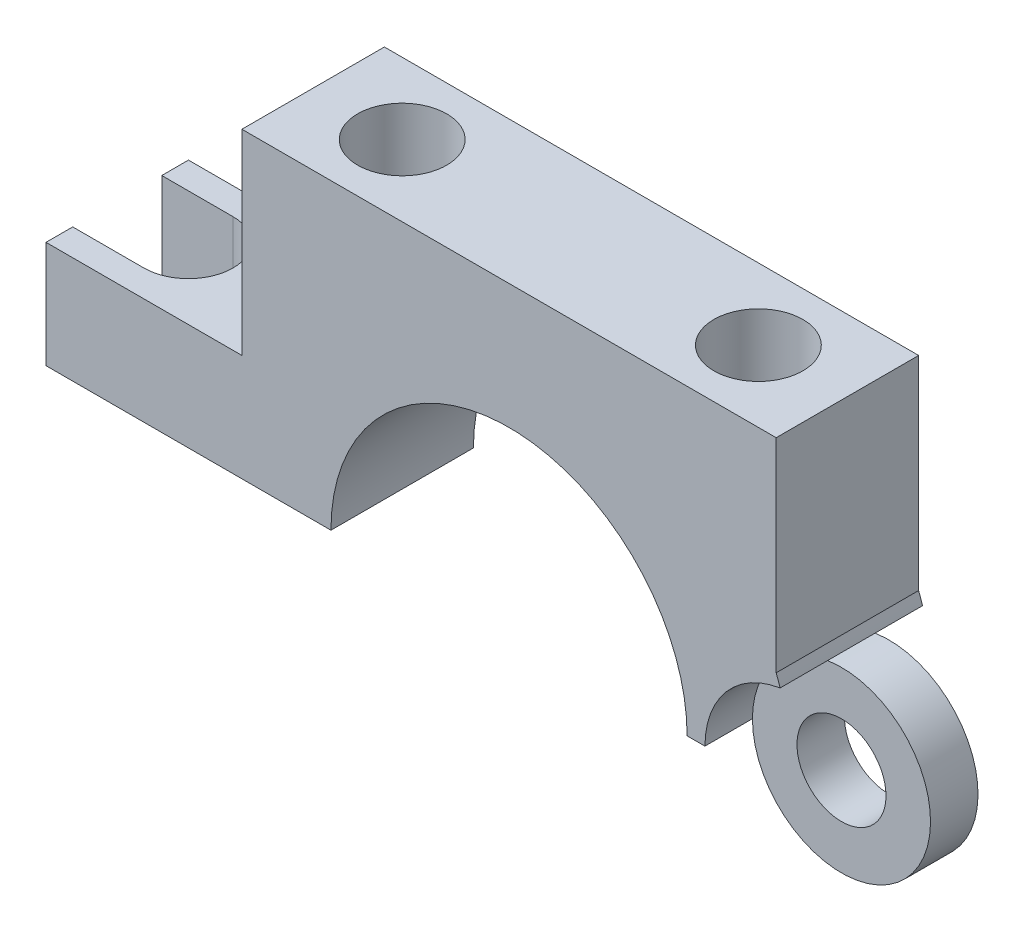
from build123d import *
from OCP.BRepAlgoAPI import BRepAlgoAPI_Cut
from OCP.TopTools import TopTools_ListOfShape

# Parameters (mm, degrees)
BOSS_EXTRUDE1_DEPTH     = 2
SKETCH2_R               = 2.5
BOSS_EXTRUDE2_DEPTH     = 0.666666667
CUT_EXTRUDE1_START      = -4
SKETCH3_R               = 1.25
CUT_EXTRUDE1_DEPTH      = 4
CUT_EXTRUDE3_DEPTH      = 15.256577429
CUT_EXTRUDE3_DEPTH_BACK = 3
BOSS_EXTRUDE3_DEPTH     = 2
CUT_EXTRUDE8_START      = -0.666667
SKETCH7_R               = 2.5
CUT_EXTRUDE8_DEPTH      = 1.333333333
CUT_EXTRUDE9_START      = 2.000000333
SKETCH8_R               = 2.5
CUT_EXTRUDE9_DEPTH      = 1.333333333
SKETCH9_R               = 1.25
CUT_EXTRUDE10_DEPTH     = 5


with BuildPart() as part:
    # Sketch1 → Boss-Extrude1 (new, symmetric)
    with BuildSketch(Plane.XY):
        with BuildLine():
            Line((-8, 0), (-5, 0))
            ThreePointArc((-5, 0), (0, 5), (5, 0))
            Line((5, 0), (8, 0))
            ThreePointArc((8, 0), (1.5281381, 7.85269342), (-7.416198487, 3))
            ThreePointArc((-7.416198487, 3), (-7.85269342, 1.5281381), (-8, 0))
        make_face()
        with BuildLine():
            Line((-13, 0), (-8, 0))
            ThreePointArc((-8, 0), (-7.85269342, 1.5281381), (-7.416198487, 3))
            Line((-7.416198487, 3), (-13, 3))
            Line((-13, 3), (-13, 0))
        make_face()
    extrude(amount=BOSS_EXTRUDE1_DEPTH, both=True)

    # Sketch2 → Boss-Extrude2 (add, symmetric)
    with BuildSketch(Plane.XY):
        with Locations((8, 0)):
            Circle(SKETCH2_R)
    extrude(amount=BOSS_EXTRUDE2_DEPTH, both=True)

    # Sketch3 → Cut-Extrude1 (cut)
    with BuildSketch(Plane.XY.offset(2).offset(CUT_EXTRUDE1_START)):
        with Locations(Location((8, 0, 0), (0, 0, 94.480798786))):
            Circle(SKETCH3_R)
    extrude(amount=CUT_EXTRUDE1_DEPTH, mode=Mode.SUBTRACT)

    # Sketch4 → Cut-Extrude3 (cut, two sides: drawn at the far end of the back side and taken through both)
    with BuildSketch(Plane(origin=(0, 3, 0), x_dir=(1, 0, 0), z_dir=(0, 1, 0)).offset(-CUT_EXTRUDE3_DEPTH_BACK)):
        with BuildLine():
            ThreePointArc((-11, -1.25), (-9.75, 0), (-11, 1.25))
            Line((-11, 1.25), (-13, 1.25))
            Line((-13, 1.25), (-13, -1.25))
            Line((-13, -1.25), (-11, -1.25))
        make_face()
    extrude(amount=CUT_EXTRUDE3_DEPTH + CUT_EXTRUDE3_DEPTH_BACK, mode=Mode.SUBTRACT)

    # Sketch6 → Boss-Extrude3 (add, symmetric)
    with BuildSketch(Plane.XY):
        with BuildLine():
            Line((7.5, 8.5), (-7.5, 8.5))
            Line((-7.5, 8.5), (-7.5, 2.783882181))
            ThreePointArc((-7.5, 2.783882181), (0, 8), (7.5, 2.783882181))
            Line((7.5, 2.783882181), (7.5, 8.5))
        make_face()
    extrude(amount=BOSS_EXTRUDE3_DEPTH, both=True)


with BuildPart() as cut_extrude8_tool:
    # Sketch7 → Cut-Extrude8 (new body)
    with BuildSketch(Plane.XY.offset(CUT_EXTRUDE8_START)):
        with Locations((8, 0)):
            Circle(SKETCH7_R)
    extrude(amount=-CUT_EXTRUDE8_DEPTH)


with BuildPart() as part_1:
    add(part.part)

    # Cut-Extrude8: cut by cut_extrude8_tool, with a tolerance
    cut_extrude8_stock = TopTools_ListOfShape()
    cut_extrude8_stock.Append(part_1.part.wrapped)
    cut_extrude8_tools = TopTools_ListOfShape()
    cut_extrude8_tools.Append(cut_extrude8_tool.part.wrapped)
    cut_extrude8_cut = BRepAlgoAPI_Cut()
    cut_extrude8_cut.SetArguments(cut_extrude8_stock)
    cut_extrude8_cut.SetTools(cut_extrude8_tools)
    cut_extrude8_cut.SetFuzzyValue(0.00001)
    cut_extrude8_cut.Build()
    add(Compound.cast(cut_extrude8_cut.Shape()).solids(), mode=Mode.REPLACE)


with BuildPart() as cut_extrude9_tool:
    # Sketch8 → Cut-Extrude9 (new body)
    with BuildSketch(Plane.XY.offset(CUT_EXTRUDE9_START)):
        with Locations((8, 0)):
            Circle(SKETCH8_R)
    extrude(amount=-CUT_EXTRUDE9_DEPTH)


with BuildPart() as part_2:
    add(part_1.part)

    # Cut-Extrude9: cut by cut_extrude9_tool, with a tolerance
    cut_extrude9_stock = TopTools_ListOfShape()
    cut_extrude9_stock.Append(part_2.part.wrapped)
    cut_extrude9_tools = TopTools_ListOfShape()
    cut_extrude9_tools.Append(cut_extrude9_tool.part.wrapped)
    cut_extrude9_cut = BRepAlgoAPI_Cut()
    cut_extrude9_cut.SetArguments(cut_extrude9_stock)
    cut_extrude9_cut.SetTools(cut_extrude9_tools)
    cut_extrude9_cut.SetFuzzyValue(0.00001)
    cut_extrude9_cut.Build()
    add(Compound.cast(cut_extrude9_cut.Shape()).solids(), mode=Mode.REPLACE)

    # Sketch9 → Cut-Extrude10 (cut)
    with BuildSketch(Plane(origin=(0, 8.5, 0), x_dir=(1, 0, 0), z_dir=(0, 1, 0))):
        with Locations(Location((-5, 0, 0), (0, 0, 180))):
            Circle(SKETCH9_R)
        with Locations(Location((5, 0, 0), (0, 0, 180))):
            Circle(SKETCH9_R)
    extrude(amount=-CUT_EXTRUDE10_DEPTH, mode=Mode.SUBTRACT)


solid = part_2.part
